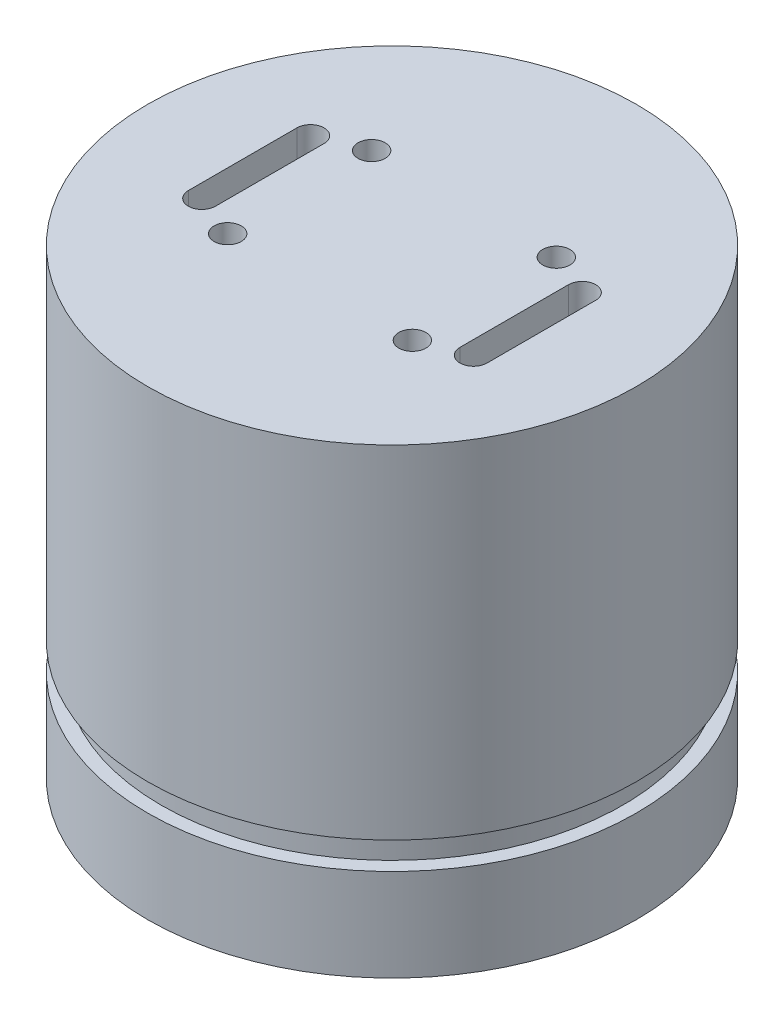
from build123d import *

# Parameters (mm, degrees)
SKETCH1_R           = 90
BOSS_EXTRUDE1_DEPTH = 10
SKETCH2_R           = 5
CUT_EXTRUDE1_DEPTH  = 128.671453348
BOSS_EXTRUDE2_START = 150
SKETCH3_R           = 90
SKETCH3_R_2         = 80
BOSS_EXTRUDE2_DEPTH = 150
CUT_EXTRUDE2_DEPTH  = 205.450483003
BOSS_EXTRUDE4_START = 10
SKETCH8_R           = 90
BOSS_EXTRUDE4_DEPTH = 10
CUT_EXTRUDE3_REACH  = 214.368
SKETCH9_R           = 1.5
CUT_EXTRUDE4_START  = -34
SKETCH10_R          = 90
SKETCH10_R_2        = 85
CUT_EXTRUDE4_DEPTH  = 10
SKETCH11_R          = 2.5


with BuildPart() as part:
    # Sketch1 → Boss-Extrude1 (new body)
    with BuildSketch(Plane(origin=(0, 0, 0), x_dir=(1, 0, 0), z_dir=(0, 1, 0))):
        Circle(SKETCH1_R)
    extrude(amount=BOSS_EXTRUDE1_DEPTH)

    # Sketch2 → Cut-Extrude1 (cut, through all)
    with BuildSketch(Plane(origin=(0, 10, 0), x_dir=(1, 0, 0), z_dir=(0, 1, 0))):
        with Locations((-34, -26.5)):
            Circle(SKETCH2_R)
        with Locations((34, -26.5)):
            Circle(SKETCH2_R)
        with Locations((34, 26.5)):
            Circle(SKETCH2_R)
        with Locations((-34, 26.5)):
            Circle(SKETCH2_R)
    extrude(amount=-CUT_EXTRUDE1_DEPTH, mode=Mode.SUBTRACT)

    # Sketch3 → Boss-Extrude2 (add)
    with BuildSketch(Plane.XZ.offset(BOSS_EXTRUDE2_START)):
        Circle(SKETCH3_R)
        Circle(SKETCH3_R_2, mode=Mode.SUBTRACT)
    extrude(amount=-BOSS_EXTRUDE2_DEPTH)

    # Sketch4 → Cut-Extrude2 (cut, through all)
    with BuildSketch(Plane(origin=(0, 10, 0), x_dir=(1, 0, 0), z_dir=(0, 1, 0))):
        with BuildLine():
            Line((55, 20), (55, -20))
            ThreePointArc((55, -20), (50, -25), (45, -20))
            Line((45, -20), (45, 20))
            ThreePointArc((45, 20), (50, 25), (55, 20))
        make_face()
    cut_extrude2 = extrude(amount=-CUT_EXTRUDE2_DEPTH, mode=Mode.SUBTRACT)

    # Mirror1: Cut-Extrude2 across plane
    add(cut_extrude2.mirror(Plane(origin=(0, 0, 0), x_dir=(0, 0, 1), z_dir=(1, 0, 0))), mode=Mode.SUBTRACT)

    # Sketch8 → Boss-Extrude4 (add)
    with BuildSketch(Plane.XZ.offset(150).offset(BOSS_EXTRUDE4_START)):
        Circle(SKETCH8_R)
    extrude(amount=-BOSS_EXTRUDE4_DEPTH)

    # Sketch9 → Cut-Extrude3 (cut, up to next)
    with BuildSketch(Plane.XZ.offset(160), mode=Mode.PRIVATE) as cut_extrude3_sk1:
        with Locations((6.5, 15.5)):
            Circle(SKETCH9_R)
    cut_extrude3_tool1 = extrude(cut_extrude3_sk1.sketch, amount=-CUT_EXTRUDE3_REACH, mode=Mode.PRIVATE) & part.part
    # Sketch9 → Cut-Extrude3 (cut, up to next)
    with BuildSketch(Plane.XZ.offset(160), mode=Mode.PRIVATE) as cut_extrude3_sk2:
        with Locations((37.5, 15.5)):
            Circle(SKETCH9_R)
    cut_extrude3_tool2 = extrude(cut_extrude3_sk2.sketch, amount=-CUT_EXTRUDE3_REACH, mode=Mode.PRIVATE) & part.part
    # Sketch9 → Cut-Extrude3 (cut, up to next)
    with BuildSketch(Plane.XZ.offset(160), mode=Mode.PRIVATE) as cut_extrude3_sk3:
        with Locations((6.5, -15.5)):
            Circle(SKETCH9_R)
    cut_extrude3_tool3 = extrude(cut_extrude3_sk3.sketch, amount=-CUT_EXTRUDE3_REACH, mode=Mode.PRIVATE) & part.part
    # Sketch9 → Cut-Extrude3 (cut, up to next)
    with BuildSketch(Plane.XZ.offset(160), mode=Mode.PRIVATE) as cut_extrude3_sk4:
        with Locations((37.5, -15.5)):
            Circle(SKETCH9_R)
    cut_extrude3_tool4 = extrude(cut_extrude3_sk4.sketch, amount=-CUT_EXTRUDE3_REACH, mode=Mode.PRIVATE) & part.part
    # Sketch9 → Cut-Extrude3 (cut, up to next)
    with BuildSketch(Plane.XZ.offset(160), mode=Mode.PRIVATE) as cut_extrude3_sk5:
        with Locations((-6.5, -15.5)):
            Circle(SKETCH9_R)
    cut_extrude3_tool5 = extrude(cut_extrude3_sk5.sketch, amount=-CUT_EXTRUDE3_REACH, mode=Mode.PRIVATE) & part.part
    # Sketch9 → Cut-Extrude3 (cut, up to next)
    with BuildSketch(Plane.XZ.offset(160), mode=Mode.PRIVATE) as cut_extrude3_sk6:
        with Locations((-37.5, -15.5)):
            Circle(SKETCH9_R)
    cut_extrude3_tool6 = extrude(cut_extrude3_sk6.sketch, amount=-CUT_EXTRUDE3_REACH, mode=Mode.PRIVATE) & part.part
    # Sketch9 → Cut-Extrude3 (cut, up to next)
    with BuildSketch(Plane.XZ.offset(160), mode=Mode.PRIVATE) as cut_extrude3_sk7:
        with Locations((-37.5, 15.5)):
            Circle(SKETCH9_R)
    cut_extrude3_tool7 = extrude(cut_extrude3_sk7.sketch, amount=-CUT_EXTRUDE3_REACH, mode=Mode.PRIVATE) & part.part
    # Sketch9 → Cut-Extrude3 (cut, up to next)
    with BuildSketch(Plane.XZ.offset(160), mode=Mode.PRIVATE) as cut_extrude3_sk8:
        with Locations((-6.5, 15.5)):
            Circle(SKETCH9_R)
    cut_extrude3_tool8 = extrude(cut_extrude3_sk8.sketch, amount=-CUT_EXTRUDE3_REACH, mode=Mode.PRIVATE) & part.part
    add(cut_extrude3_tool1.solids().sort_by_distance((6.5, -160, 15.5))[0], mode=Mode.SUBTRACT)
    add(cut_extrude3_tool2.solids().sort_by_distance((37.5, -160, 15.5))[0], mode=Mode.SUBTRACT)
    add(cut_extrude3_tool3.solids().sort_by_distance((6.5, -160, -15.5))[0], mode=Mode.SUBTRACT)
    add(cut_extrude3_tool4.solids().sort_by_distance((37.5, -160, -15.5))[0], mode=Mode.SUBTRACT)
    add(cut_extrude3_tool5.solids().sort_by_distance((-6.5, -160, -15.5))[0], mode=Mode.SUBTRACT)
    add(cut_extrude3_tool6.solids().sort_by_distance((-37.5, -160, -15.5))[0], mode=Mode.SUBTRACT)
    add(cut_extrude3_tool7.solids().sort_by_distance((-37.5, -160, 15.5))[0], mode=Mode.SUBTRACT)
    add(cut_extrude3_tool8.solids().sort_by_distance((-6.5, -160, 15.5))[0], mode=Mode.SUBTRACT)

    # Sketch10 → Cut-Extrude4 (cut)
    with BuildSketch(Plane.XZ.offset(160).offset(CUT_EXTRUDE4_START)):
        Circle(SKETCH10_R)
        Circle(SKETCH10_R_2, mode=Mode.SUBTRACT)
    extrude(amount=-CUT_EXTRUDE4_DEPTH, mode=Mode.SUBTRACT)

    # Sketch11 → Cut-Revolve1 (revolve, cut)
    with BuildSketch(Plane.XY):
        with Locations((85, -160)):
            Circle(SKETCH11_R)
    revolve(axis=Axis((0, -160, 0), (0, 1, 0)), mode=Mode.SUBTRACT)


solid = part.part
